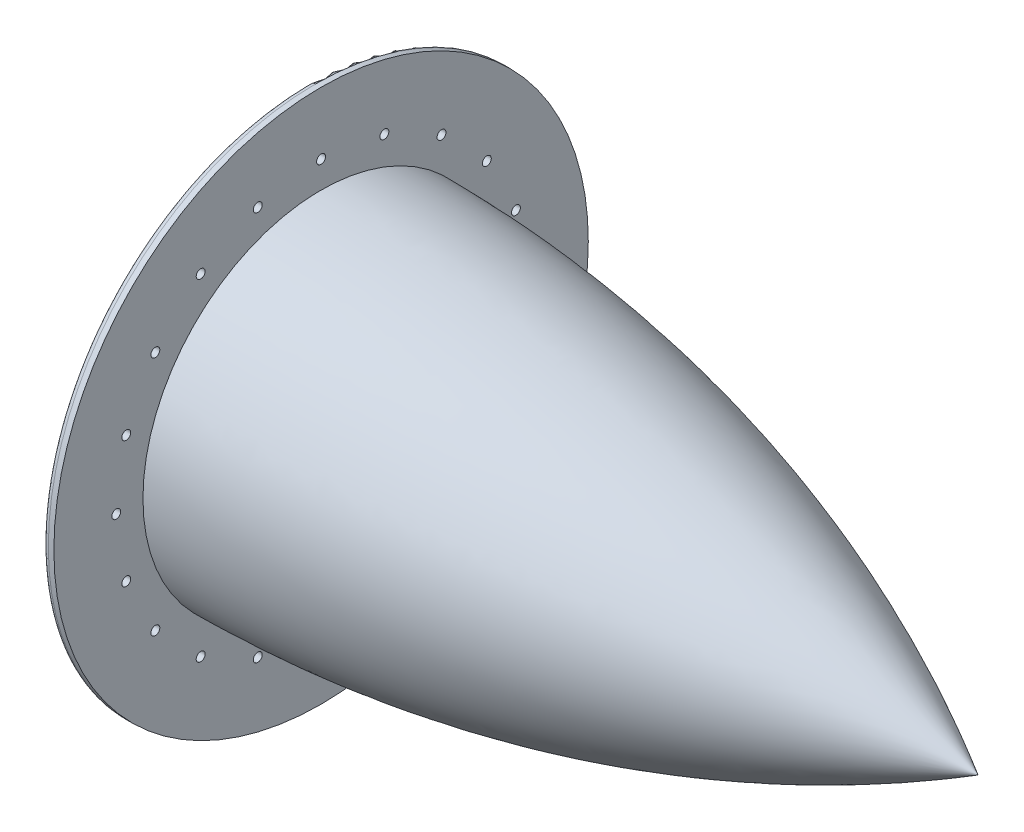
from build123d import *

# Parameters (mm, degrees)
SKETCH2_R           = 120
SKETCH2_R_2         = 69.999924074
BOSS_EXTRUDE1_DEPTH = 5
SKETCH3_R           = 2
CUT_EXTRUDE1_DEPTH  = 5
FILLET1_R           = 2.5


# Read off the part's stored shape, not the designer's step: Shell1
with BuildPart() as part:
    # Sketch1 → Revolve1 (revolve)
    with BuildSketch(Plane.XY):
        with BuildLine():
            Line((-107.84114053, 0), (-107.84114053, 80))
            ThreePointArc((-107.84114053, 80), (47.479230848, 59.951392665), (192.15885947, 0))
            Line((192.15885947, 0), (-107.84114053, 0))
        make_face()
    revolve(axis=Axis((-149.694501018, 0, 0), (1, 0, 0)))

    # Shell1 outline → Shell1 (revolve, cut)
    with BuildSketch(Plane.YX):
        with BuildLine():
            add(Edge.make_bspline(
                [(69.999924074, -107.84114053), (70.001727321, -107.382306322), (70.00308009, -106.923413868), (70.003982157, -106.464464036), (70.004433299, -106.005457698), (70.004433073, -48.348141986), (62.997971324, 9.75652541), (48.561877681, 66.908070429), (27.14287997, 121.356623894), (0, 171.672716328)],
                knots=[6.283145264, 6.283145264, 6.283145264, 6.283145264, 6.283145264, 6.283145264, 6.28711535, 6.28711535, 6.28711535, 6.28711535, 6.781780548, 6.781780548, 6.781780548, 6.781780548, 6.781780548, 6.781780548], degree=5, weights=[1, 1, 1, 1, 1, 1, 0.999629282, 0.999629645, 1, 1]))
            Line((0, 171.672716328), (0, -107.84114063))
            Line((0, -107.84114063), (69.999924074, -107.84114053))
        make_face()
    revolve(axis=Axis((0, 0, 0), (1, 0, 0)), mode=Mode.SUBTRACT)

    # Sketch2 → Boss-Extrude1 (add)
    with BuildSketch(Plane.ZY.offset(107.84114053)):
        Circle(SKETCH2_R)
        Circle(SKETCH2_R_2, mode=Mode.SUBTRACT)
    extrude(amount=-BOSS_EXTRUDE1_DEPTH)

    # Sketch3 → Cut-Extrude1 (cut)
    with BuildSketch(Plane.ZY.offset(107.84114053)):
        with Locations((0, 92)):
            Circle(SKETCH3_R)
        with Locations((28.429563482, 87.497199499)):
            Circle(SKETCH3_R)
        with Locations((54.076243211, 74.429563482)):
            Circle(SKETCH3_R)
        with Locations((74.429563482, 54.076243211)):
            Circle(SKETCH3_R)
        with Locations((87.497199499, 28.429563482)):
            Circle(SKETCH3_R)
        with Locations((92, 0)):
            Circle(SKETCH3_R)
        with Locations((87.497199499, -28.429563482)):
            Circle(SKETCH3_R)
        with Locations((74.429563483, -54.076243211)):
            Circle(SKETCH3_R)
        with Locations((54.076243211, -74.429563482)):
            Circle(SKETCH3_R)
        with Locations((28.429563483, -87.497199499)):
            Circle(SKETCH3_R)
        with Locations((0, -92)):
            Circle(SKETCH3_R)
        with Locations((-28.429563482, -87.497199499)):
            Circle(SKETCH3_R)
        with Locations((-54.076243211, -74.429563482)):
            Circle(SKETCH3_R)
        with Locations((-74.429563482, -54.076243211)):
            Circle(SKETCH3_R)
        with Locations((-87.497199499, -28.429563482)):
            Circle(SKETCH3_R)
        with Locations((-92, 0)):
            Circle(SKETCH3_R)
        with Locations((-87.497199499, 28.429563482)):
            Circle(SKETCH3_R)
        with Locations((-74.429563482, 54.076243211)):
            Circle(SKETCH3_R)
        with Locations((-54.076243211, 74.429563482)):
            Circle(SKETCH3_R)
        with Locations((-28.429563482, 87.497199499)):
            Circle(SKETCH3_R)
    extrude(amount=-CUT_EXTRUDE1_DEPTH, mode=Mode.SUBTRACT)

    # Fillet1
    fillet1_edges = [part.edges().sort_by_distance(p)[0] for p in [
        (-107.84114053, 0, -120),
    ]]
    fillet(fillet1_edges, radius=FILLET1_R)


solid = part.part
